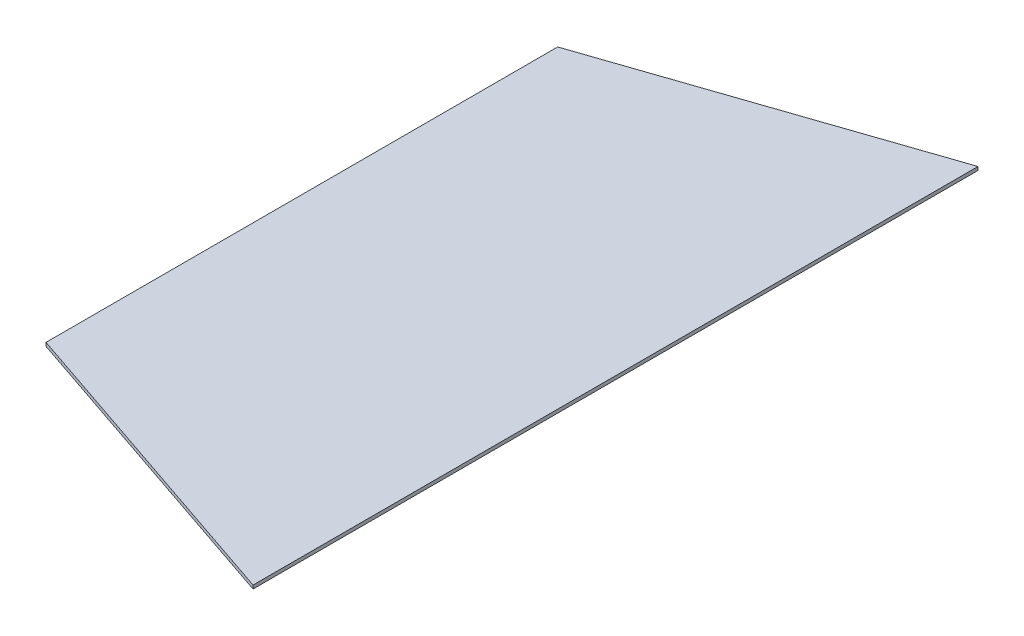
from build123d import *

# Parameters (mm, degrees)
SKETCH1_W           = 508
SKETCH1_H           = 528.32
BOSS_EXTRUDE1_DEPTH = 2.54
CUT_EXTRUDE1_DEPTH  = 2.54
CUT_EXTRUDE4_DEPTH  = 2.54


with BuildPart() as part:
    # Sketch1 → Boss-Extrude1 (new body)
    with BuildSketch(Plane(origin=(0, 0, 0), x_dir=(1, 0, 0), z_dir=(0, 1, 0))):
        with Locations((42.412757974, -202.68532833)):
            Rectangle(SKETCH1_W, SKETCH1_H)
    extrude(amount=BOSS_EXTRUDE1_DEPTH)

    # Sketch2 → Cut-Extrude1 (cut)
    with BuildSketch(Plane(origin=(0, 2.54, 0), x_dir=(1, 0, 0), z_dir=(0, 1, 0))):
        Polygon((296.412757974, -466.84532833), (-211.587242026, -294.12532833), (-211.587242026, -466.84532833), align=None)
        Polygon((296.412757974, 61.47467167), (-211.587242026, -111.24532833), (-211.587242026, 61.47467167), align=None)
    extrude(amount=-CUT_EXTRUDE1_DEPTH, mode=Mode.SUBTRACT)

    # Sketch5 → Cut-Extrude4 (cut)
    with BuildSketch(Plane(origin=(0, 2.54, 0), x_dir=(1, 0, 0), z_dir=(0, 1, 0))):
        Polygon((67.812757974, -16.24932833), (-211.587242026, -111.24532833), (-211.587242026, -294.12532833), (67.812757974, -389.12132833), align=None)
    extrude(amount=-CUT_EXTRUDE4_DEPTH, mode=Mode.SUBTRACT)


solid = part.part
